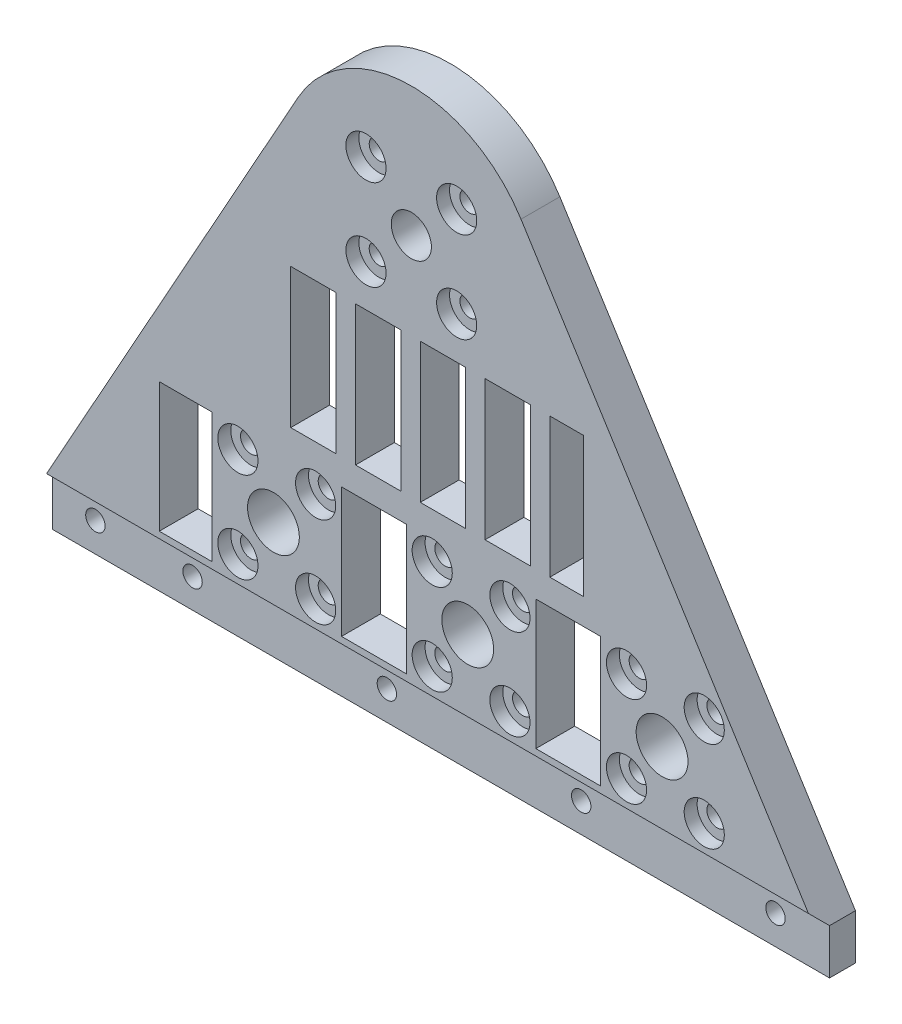
from build123d import *

# Parameters (mm, degrees)
SKETCH_1_R           = 3.1
EXTRUDE_1_DEPTH      = 6
SKETCH_2_R           = 3.1
CUT_EXTRUDE_6_DEPTH  = 2
SKETCH_4_R           = 1.5
CUT_EXTRUDE_7_DEPTH  = 118.034622889
CUT_EXTRUDE_8_REACH  = 119.12
SKETCH_5_W           = 7
SKETCH_5_H           = 21.556656584
SKETCH_5_W_2         = 5.195776916
SKETCH_5_R           = 4
SKETCH_5_W_3         = 8.137387099
SKETCH_5_H_2         = 20
SKETCH_5_W_4         = 10
SKETCH_6_R           = 3.1
CUT_EXTRUDE_9_DEPTH  = 2
SKETCH_7_R           = 1.6
CUT_EXTRUDE_10_DEPTH = 118.034622889
SKETCH_8_R           = 1.5
CUT_EXTRUDE_11_DEPTH = 118.120036521
SKETCH_9_W           = 120
SKETCH_9_H           = 5
CUT_EXTRUDE_12_DEPTH = 2
CHAMFER_1_SIZE       = 2
SKETCH_10_W          = 120
SKETCH_10_H          = 4
EXTRUDE_2_DEPTH      = 2


with BuildPart() as part:
    # 草图1 → 凸台-拉伸1 (new body)
    with BuildSketch(Plane.XY):
        with BuildLine():
            Line((53.211823486, 15.105307707), (98.846336292, -57.534028788))
            Line((98.846336292, -57.534028788), (98.846336292, -62.534028788))
            Line((98.846336292, -62.534028788), (-21.153663708, -62.534028788))
            Line((-21.153663708, -62.534028788), (-21.153663708, -57.534028788))
            Line((-21.153663708, -57.534028788), (18.804405563, 14.198660069))
            ThreePointArc((18.804405563, 14.198660069), (35.749695352, 24.459031414), (53.211823486, 15.105307707))
        make_face()
        with Locations((36.276519563, 4.465971212)):
            Circle(SKETCH_1_R, mode=Mode.SUBTRACT)
    extrude(amount=EXTRUDE_1_DEPTH)

    # 草图2 → 切除-拉伸6 (cut)
    with BuildSketch(Plane.XY.offset(6)):
        with Locations((29.276519563, 11.465971212)):
            Circle(SKETCH_2_R)
        with Locations(Location((43.276519563, 11.465971212, 0), (0, 0, 180))):
            Circle(SKETCH_2_R)
        with Locations((43.276519563, -2.534028788)):
            Circle(SKETCH_2_R)
        with Locations(Location((29.276519563, -2.534028788, 0), (0, 0, 180))):
            Circle(SKETCH_2_R)
    extrude(amount=-CUT_EXTRUDE_6_DEPTH, mode=Mode.SUBTRACT)

    # 草图4 → 切除-拉伸7 (cut, through all)
    with BuildSketch(Plane.XY.offset(4)):
        with Locations((43.276519563, 11.465971212)):
            Circle(SKETCH_4_R)
        with Locations((43.276519563, -2.534028788)):
            Circle(SKETCH_4_R)
        with Locations((29.276519563, -2.534028788)):
            Circle(SKETCH_4_R)
        with Locations((29.276519563, 11.465971212)):
            Circle(SKETCH_4_R)
    extrude(amount=-CUT_EXTRUDE_7_DEPTH, mode=Mode.SUBTRACT)

    # 草图5 → 切除-拉伸8 (cut, up to next)
    with BuildSketch(Plane.XY.offset(6), mode=Mode.PRIVATE) as cut_extrude_8_sk1:
        with Locations((21.160819148, -19.755700496)):
            Rectangle(SKETCH_5_W, SKETCH_5_H)
    cut_extrude_8_tool1 = extrude(cut_extrude_8_sk1.sketch, amount=-CUT_EXTRUDE_8_REACH, mode=Mode.PRIVATE) & part.part
    # 草图5 → 切除-拉伸8 (cut, up to next)
    with BuildSketch(Plane.XY.offset(6), mode=Mode.PRIVATE) as cut_extrude_8_sk2:
        with Locations((31.160819148, -19.755700496)):
            Rectangle(SKETCH_5_W, SKETCH_5_H)
    cut_extrude_8_tool2 = extrude(cut_extrude_8_sk2.sketch, amount=-CUT_EXTRUDE_8_REACH, mode=Mode.PRIVATE) & part.part
    # 草图5 → 切除-拉伸8 (cut, up to next)
    with BuildSketch(Plane.XY.offset(6), mode=Mode.PRIVATE) as cut_extrude_8_sk3:
        with Locations((41.160819148, -19.755700496)):
            Rectangle(SKETCH_5_W, SKETCH_5_H)
    cut_extrude_8_tool3 = extrude(cut_extrude_8_sk3.sketch, amount=-CUT_EXTRUDE_8_REACH, mode=Mode.PRIVATE) & part.part
    # 草图5 → 切除-拉伸8 (cut, up to next)
    with BuildSketch(Plane.XY.offset(6), mode=Mode.PRIVATE) as cut_extrude_8_sk4:
        with Locations((51.160819148, -19.755700496)):
            Rectangle(SKETCH_5_W, SKETCH_5_H)
    cut_extrude_8_tool4 = extrude(cut_extrude_8_sk4.sketch, amount=-CUT_EXTRUDE_8_REACH, mode=Mode.PRIVATE) & part.part
    # 草图5 → 切除-拉伸8 (cut, up to next)
    with BuildSketch(Plane.XY.offset(6), mode=Mode.PRIVATE) as cut_extrude_8_sk5:
        with Locations((60.258707606, -19.755700496)):
            Rectangle(SKETCH_5_W_2, SKETCH_5_H)
    cut_extrude_8_tool5 = extrude(cut_extrude_8_sk5.sketch, amount=-CUT_EXTRUDE_8_REACH, mode=Mode.PRIVATE) & part.part
    # 草图5 → 切除-拉伸8 (cut, up to next)
    with BuildSketch(Plane.XY.offset(6), mode=Mode.PRIVATE) as cut_extrude_8_sk6:
        with Locations((14.988200827, -44.534028788)):
            Circle(SKETCH_5_R)
    cut_extrude_8_tool6 = extrude(cut_extrude_8_sk6.sketch, amount=-CUT_EXTRUDE_8_REACH, mode=Mode.PRIVATE) & part.part
    # 草图5 → 切除-拉伸8 (cut, up to next)
    with BuildSketch(Plane.XY.offset(6), mode=Mode.PRIVATE) as cut_extrude_8_sk7:
        with Locations((44.988200827, -44.534028788)):
            Circle(SKETCH_5_R)
    cut_extrude_8_tool7 = extrude(cut_extrude_8_sk7.sketch, amount=-CUT_EXTRUDE_8_REACH, mode=Mode.PRIVATE) & part.part
    # 草图5 → 切除-拉伸8 (cut, up to next)
    with BuildSketch(Plane.XY.offset(6), mode=Mode.PRIVATE) as cut_extrude_8_sk8:
        with Locations((74.988200827, -44.534028788)):
            Circle(SKETCH_5_R)
    cut_extrude_8_tool8 = extrude(cut_extrude_8_sk8.sketch, amount=-CUT_EXTRUDE_8_REACH, mode=Mode.PRIVATE) & part.part
    # 草图5 → 切除-拉伸8 (cut, up to next)
    with BuildSketch(Plane.XY.offset(6), mode=Mode.PRIVATE) as cut_extrude_8_sk9:
        with Locations((1.433627507, -44.534028788)):
            Rectangle(SKETCH_5_W_3, SKETCH_5_H_2)
    cut_extrude_8_tool9 = extrude(cut_extrude_8_sk9.sketch, amount=-CUT_EXTRUDE_8_REACH, mode=Mode.PRIVATE) & part.part
    # 草图5 → 切除-拉伸8 (cut, up to next)
    with BuildSketch(Plane.XY.offset(6), mode=Mode.PRIVATE) as cut_extrude_8_sk10:
        with Locations((30.502321056, -44.534028788)):
            Rectangle(SKETCH_5_W_4, SKETCH_5_H_2)
    cut_extrude_8_tool10 = extrude(cut_extrude_8_sk10.sketch, amount=-CUT_EXTRUDE_8_REACH, mode=Mode.PRIVATE) & part.part
    # 草图5 → 切除-拉伸8 (cut, up to next)
    with BuildSketch(Plane.XY.offset(6), mode=Mode.PRIVATE) as cut_extrude_8_sk11:
        with Locations((60.502321056, -44.534028788)):
            Rectangle(SKETCH_5_W_4, SKETCH_5_H_2)
    cut_extrude_8_tool11 = extrude(cut_extrude_8_sk11.sketch, amount=-CUT_EXTRUDE_8_REACH, mode=Mode.PRIVATE) & part.part
    add(cut_extrude_8_tool1.solids().sort_by_distance((21.160819, -19.7557, 6))[0], mode=Mode.SUBTRACT)
    add(cut_extrude_8_tool2.solids().sort_by_distance((31.160819, -19.7557, 6))[0], mode=Mode.SUBTRACT)
    add(cut_extrude_8_tool3.solids().sort_by_distance((41.160819, -19.7557, 6))[0], mode=Mode.SUBTRACT)
    add(cut_extrude_8_tool4.solids().sort_by_distance((51.160819, -19.7557, 6))[0], mode=Mode.SUBTRACT)
    add(cut_extrude_8_tool5.solids().sort_by_distance((60.258708, -19.7557, 6))[0], mode=Mode.SUBTRACT)
    add(cut_extrude_8_tool6.solids().sort_by_distance((14.988201, -44.534029, 6))[0], mode=Mode.SUBTRACT)
    add(cut_extrude_8_tool7.solids().sort_by_distance((44.988201, -44.534029, 6))[0], mode=Mode.SUBTRACT)
    add(cut_extrude_8_tool8.solids().sort_by_distance((74.988201, -44.534029, 6))[0], mode=Mode.SUBTRACT)
    add(cut_extrude_8_tool9.solids().sort_by_distance((1.433628, -44.534029, 6))[0], mode=Mode.SUBTRACT)
    add(cut_extrude_8_tool10.solids().sort_by_distance((30.502321, -44.534029, 6))[0], mode=Mode.SUBTRACT)
    add(cut_extrude_8_tool11.solids().sort_by_distance((60.502321, -44.534029, 6))[0], mode=Mode.SUBTRACT)

    # 草图6 → 切除-拉伸9 (cut)
    with BuildSketch(Plane.XY.offset(6)):
        with Locations((21.502321056, -37.534028788)):
            Circle(SKETCH_6_R)
        with Locations((9.502321056, -37.534028788)):
            Circle(SKETCH_6_R)
        with Locations((9.502321056, -51.534028788)):
            Circle(SKETCH_6_R)
        with Locations((21.502321056, -51.534028788)):
            Circle(SKETCH_6_R)
        with Locations((39.502321056, -37.534028788)):
            Circle(SKETCH_6_R)
        with Locations((51.502321056, -37.534028788)):
            Circle(SKETCH_6_R)
        with Locations((51.502321056, -51.534028788)):
            Circle(SKETCH_6_R)
        with Locations((39.502321056, -51.534028788)):
            Circle(SKETCH_6_R)
        with Locations((69.502321056, -37.534028788)):
            Circle(SKETCH_6_R)
        with Locations((81.502321056, -37.534028788)):
            Circle(SKETCH_6_R)
        with Locations((81.502321056, -51.534028788)):
            Circle(SKETCH_6_R)
        with Locations((69.502321056, -51.534028788)):
            Circle(SKETCH_6_R)
    extrude(amount=-CUT_EXTRUDE_9_DEPTH, mode=Mode.SUBTRACT)

    # 草图7 → 切除-拉伸10 (cut, through all)
    with BuildSketch(Plane.XY.offset(4)):
        with Locations((9.502321056, -37.534028788)):
            Circle(SKETCH_7_R)
        with Locations((21.502321056, -37.534028788)):
            Circle(SKETCH_7_R)
        with Locations((9.502321056, -51.534028788)):
            Circle(SKETCH_7_R)
        with Locations((21.502321056, -51.534028788)):
            Circle(SKETCH_7_R)
        with Locations((51.502321056, -51.534028788)):
            Circle(SKETCH_7_R)
        with Locations((39.502321056, -51.534028788)):
            Circle(SKETCH_7_R)
        with Locations((39.502321056, -37.534028788)):
            Circle(SKETCH_7_R)
        with Locations((51.502321056, -37.534028788)):
            Circle(SKETCH_7_R)
        with Locations((81.502321056, -51.534028788)):
            Circle(SKETCH_7_R)
        with Locations((69.502321056, -51.534028788)):
            Circle(SKETCH_7_R)
        with Locations((69.502321056, -37.534028788)):
            Circle(SKETCH_7_R)
        with Locations((81.502321056, -37.534028788)):
            Circle(SKETCH_7_R)
    extrude(amount=-CUT_EXTRUDE_10_DEPTH, mode=Mode.SUBTRACT)

    # 草图8 → 切除-拉伸11 (cut, through all)
    with BuildSketch(Plane.XY.offset(6)):
        with Locations((90.502321056, -60.034028788)):
            Circle(SKETCH_8_R)
        with Locations((60.502321056, -60.034028788)):
            Circle(SKETCH_8_R)
        with Locations((30.502321056, -60.034028788)):
            Circle(SKETCH_8_R)
        with Locations((0.502321056, -60.034028788)):
            Circle(SKETCH_8_R)
        with Locations((-14.497678944, -60.034028788)):
            Circle(SKETCH_8_R)
    extrude(amount=-CUT_EXTRUDE_11_DEPTH, mode=Mode.SUBTRACT)

    # 草图9 → 切除-拉伸12 (cut)
    with BuildSketch(Plane.XY.offset(6)):
        with Locations((38.846336292, -60.034028788)):
            Rectangle(SKETCH_9_W, SKETCH_9_H)
    extrude(amount=-CUT_EXTRUDE_12_DEPTH, mode=Mode.SUBTRACT)

    # 倒角1
    chamfer_1_edges = [part.edges().sort_by_distance(p)[0] for p in [
        (38.846336292, -57.534028788, 6),
    ]]
    chamfer(chamfer_1_edges, length=CHAMFER_1_SIZE - 0.0001)  # a hair under: the kernel refuses the full size

    # 草图10 → 凸台-拉伸2 (add)
    with BuildSketch(Plane.XZ.offset(62.534028788)):
        with Locations((38.846336292, 2)):
            Rectangle(SKETCH_10_W, SKETCH_10_H)
    extrude(amount=EXTRUDE_2_DEPTH)


solid = part.part
